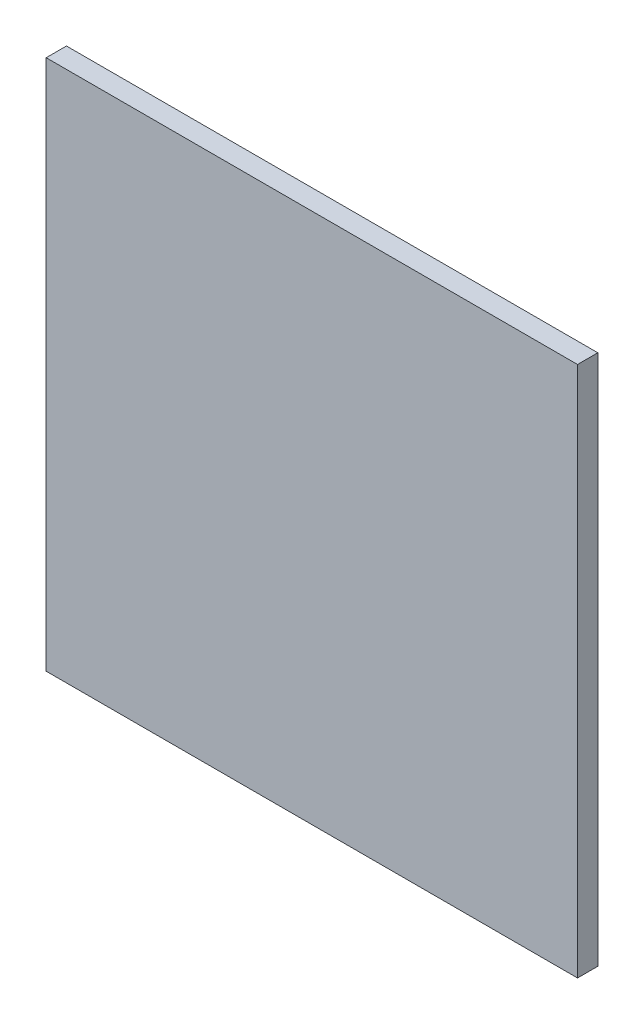
from build123d import *

# Parameters (mm, degrees)
SKIZZE2_W                       = 131
SKIZZE2_H                       = 131
AUFSATZ_LINEAR_AUSTRAGEN1_DEPTH = 5


with BuildPart() as part:
    # Skizze2 → Aufsatz-Linear austragen1 (new body)
    with BuildSketch(Plane.XY):
        Rectangle(SKIZZE2_W, SKIZZE2_H)
    extrude(amount=AUFSATZ_LINEAR_AUSTRAGEN1_DEPTH)


solid = part.part
